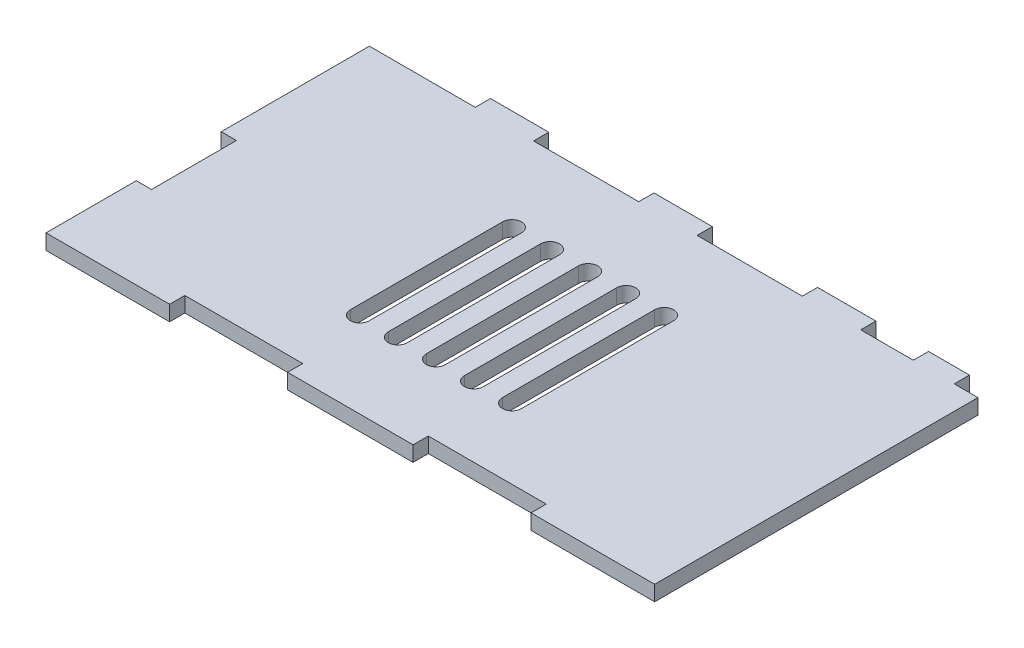
from build123d import *

# Parameters (mm, degrees)
SKETCH1_W           = 156
SKETCH1_H           = 85
BOSS_EXTRUDE1_DEPTH = 4
SKETCH2_W           = 15.33
SKETCH2_H           = 4
BOSS_EXTRUDE2_DEPTH = 4
SKETCH3_W           = 31
SKETCH3_H           = 4
CUT_EXTRUDE2_DEPTH  = 4
SKETCH4_W           = 4
SKETCH4_H           = 26.74
SKETCH4_H_2         = 28.24
BOSS_EXTRUDE3_DEPTH = 4
SKETCH5_W           = 10.75
SKETCH5_H           = 4
BOSS_EXTRUDE4_DEPTH = 4
CUT_EXTRUDE3_DEPTH  = 4
SKETCH7_W           = 4
SKETCH7_H           = 8.78
SKETCH7_H_2         = 1.92320958
BOSS_EXTRUDE5_DEPTH = 4
SKETCH8_W           = 4
SKETCH8_H           = 2.999936799
CUT_EXTRUDE4_DEPTH  = 4


with BuildPart() as part:
    # Sketch1 → Boss-Extrude1 (new body)
    with BuildSketch(Plane(origin=(0, 0, 0), x_dir=(1, 0, 0), z_dir=(0, 1, 0))):
        with Locations((78, 42.5)):
            Rectangle(SKETCH1_W, SKETCH1_H)
    extrude(amount=BOSS_EXTRUDE1_DEPTH)

    # Sketch2 → Boss-Extrude2 (add)
    with BuildSketch(Plane(origin=(0, 4, 0), x_dir=(1, 0, 0), z_dir=(0, 1, 0))):
        with Locations((31.495, 87)):
            Rectangle(SKETCH2_W, SKETCH2_H)
        with Locations((74.495, 87)):
            Rectangle(SKETCH2_W, SKETCH2_H)
        with Locations((117.495, 87)):
            Rectangle(SKETCH2_W, SKETCH2_H)
    extrude(amount=-BOSS_EXTRUDE2_DEPTH)

    # Sketch3 → Cut-Extrude2 (cut)
    with BuildSketch(Plane(origin=(0, 4, 0), x_dir=(1, 0, 0), z_dir=(0, 1, 0))):
        with Locations((44, 2)):
            Rectangle(SKETCH3_W, SKETCH3_H)
        with Locations((108, 2)):
            Rectangle(SKETCH3_W, SKETCH3_H)
    extrude(amount=-CUT_EXTRUDE2_DEPTH, mode=Mode.SUBTRACT)

    # Sketch4 → Boss-Extrude3 (add)
    with BuildSketch(Plane(origin=(0, 4, 0), x_dir=(1, 0, 0), z_dir=(0, 1, 0))):
        with Locations((-2, 13.37)):
            Rectangle(SKETCH4_W, SKETCH4_H)
        with Locations((-2, 62.1)):
            Rectangle(SKETCH4_W, SKETCH4_H_2)
    extrude(amount=-BOSS_EXTRUDE3_DEPTH)

    # Sketch5 → Boss-Extrude4 (add)
    with BuildSketch(Plane(origin=(0, 4, 0), x_dir=(1, 0, 0), z_dir=(0, 1, 0))):
        with Locations((144.375, 87)):
            Rectangle(SKETCH5_W, SKETCH5_H)
    extrude(amount=-BOSS_EXTRUDE4_DEPTH)

    # Sketch6 → Cut-Extrude3 (cut)
    with BuildSketch(Plane(origin=(0, 4, 0), x_dir=(1, 0, 0), z_dir=(0, 1, 0))):
        with BuildLine():
            Line((73.5, 62.5), (73.5, 22.5))
            ThreePointArc((73.5, 22.5), (76, 20), (78.5, 22.5))
            Line((78.5, 22.5), (78.5, 62.5))
            ThreePointArc((78.5, 62.5), (76, 65), (73.5, 62.5))
        make_face()
        with BuildLine():
            ThreePointArc((63.5, 22.5), (66, 20), (68.5, 22.5))
            Line((68.5, 22.5), (68.5, 62.5))
            ThreePointArc((68.5, 62.5), (66, 65), (63.5, 62.5))
            Line((63.5, 62.5), (63.5, 22.5))
        make_face()
        with BuildLine():
            ThreePointArc((53.5, 22.5), (56, 20), (58.5, 22.5))
            Line((58.5, 22.5), (58.5, 62.5))
            ThreePointArc((58.5, 62.5), (56, 65), (53.5, 62.5))
            Line((53.5, 62.5), (53.5, 22.5))
        make_face()
        with BuildLine():
            ThreePointArc((83.5, 22.5), (86, 20), (88.5, 22.5))
            Line((88.5, 22.5), (88.5, 62.5))
            ThreePointArc((88.5, 62.5), (86, 65), (83.5, 62.5))
            Line((83.5, 62.5), (83.5, 22.5))
        make_face()
        with BuildLine():
            ThreePointArc((93.5, 22.5), (96, 20), (98.5, 22.5))
            Line((98.5, 22.5), (98.5, 62.5))
            ThreePointArc((98.5, 62.5), (96, 65), (93.5, 62.5))
            Line((93.5, 62.5), (93.5, 22.5))
        make_face()
    extrude(amount=-CUT_EXTRUDE3_DEPTH, mode=Mode.SUBTRACT)

    # Sketch7 → Boss-Extrude5 (add)
    with BuildSketch(Plane(origin=(0, 4, 0), x_dir=(1, 0, 0), z_dir=(0, 1, 0))):
        with Locations((-2, 80.61)):
            Rectangle(SKETCH7_W, SKETCH7_H)
        with Locations((-2, 47.01839521)):
            Rectangle(SKETCH7_W, SKETCH7_H_2)
    extrude(amount=-BOSS_EXTRUDE5_DEPTH)

    # Sketch8 → Cut-Extrude4 (cut)
    with BuildSketch(Plane(origin=(0, 4, 0), x_dir=(1, 0, 0), z_dir=(0, 1, 0))):
        with Locations((-2, 25.240031601)):
            Rectangle(SKETCH8_W, SKETCH8_H)
    extrude(amount=-CUT_EXTRUDE4_DEPTH, mode=Mode.SUBTRACT)


solid = part.part
